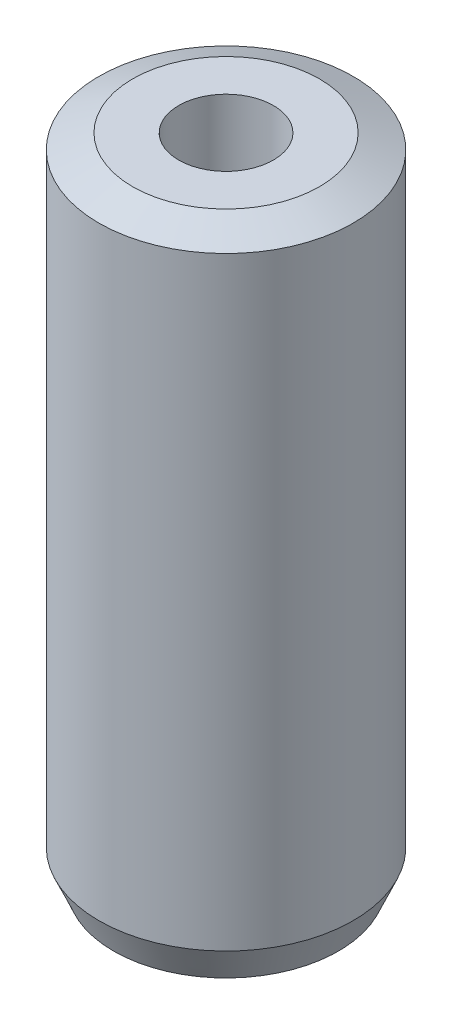
from build123d import *
from OCP.BRepFilletAPI import BRepFilletAPI_MakeChamfer

# Parameters (mm, degrees)
SKETCH1_R           = 7.5
BOSS_EXTRUDE1_DEPTH = 38.491571501
SKETCH2_R           = 2.791290389
CUT_EXTRUDE1_DEPTH  = 40.926195368
CHAMFER1_SIZE       = 0.86598428
CHAMFER1_SIZE2      = 1.988606546


with BuildPart() as part:
    # Sketch1 → Boss-Extrude1 (new body)
    with BuildSketch(Plane(origin=(0, 0, 0), x_dir=(1, 0, 0), z_dir=(0, 1, 0))):
        Circle(SKETCH1_R)
    extrude(amount=BOSS_EXTRUDE1_DEPTH)

    # Sketch2 → Cut-Extrude1 (cut, through all)
    with BuildSketch(Plane(origin=(0, 0, 0), x_dir=(1, 0, 0), z_dir=(0, 1, 0))):
        Circle(SKETCH2_R)
    extrude(amount=CUT_EXTRUDE1_DEPTH, mode=Mode.SUBTRACT)

    # Chamfer1: one chamfer whose edges measure the first distance from different faces: ONE call of the kernel's chamfer builder (chamfer() names one face for all edges)
    chamfer1_edges_1 = [part.edges().sort_by_distance(p)[0] for p in [
        (-7.5, 38.491571501, 0),
    ]]
    chamfer1_side_1 = [part.faces().sort_by_distance(p)[0] for p in [
        (-7.5, 19.24578575, 0),
    ]]
    chamfer1_edges_2 = [part.edges().sort_by_distance(p)[0] for p in [
        (-7.5, 0, 0),
    ]]
    chamfer1_side_2 = [part.faces().sort_by_distance(p)[0] for p in [
        (-7.287867966, 0, 0),
    ]]
    chamfer1 = BRepFilletAPI_MakeChamfer(part.part.solid().wrapped)
    for e in chamfer1_edges_1:
        chamfer1.Add(CHAMFER1_SIZE, CHAMFER1_SIZE2, e.wrapped, chamfer1_side_1[0].wrapped)  # the first distance lies on this face
    for e in chamfer1_edges_2:
        chamfer1.Add(CHAMFER1_SIZE, CHAMFER1_SIZE2, e.wrapped, chamfer1_side_2[0].wrapped)  # the first distance lies on this face
    add(Compound.cast(chamfer1.Shape()), mode=Mode.REPLACE)


solid = part.part
